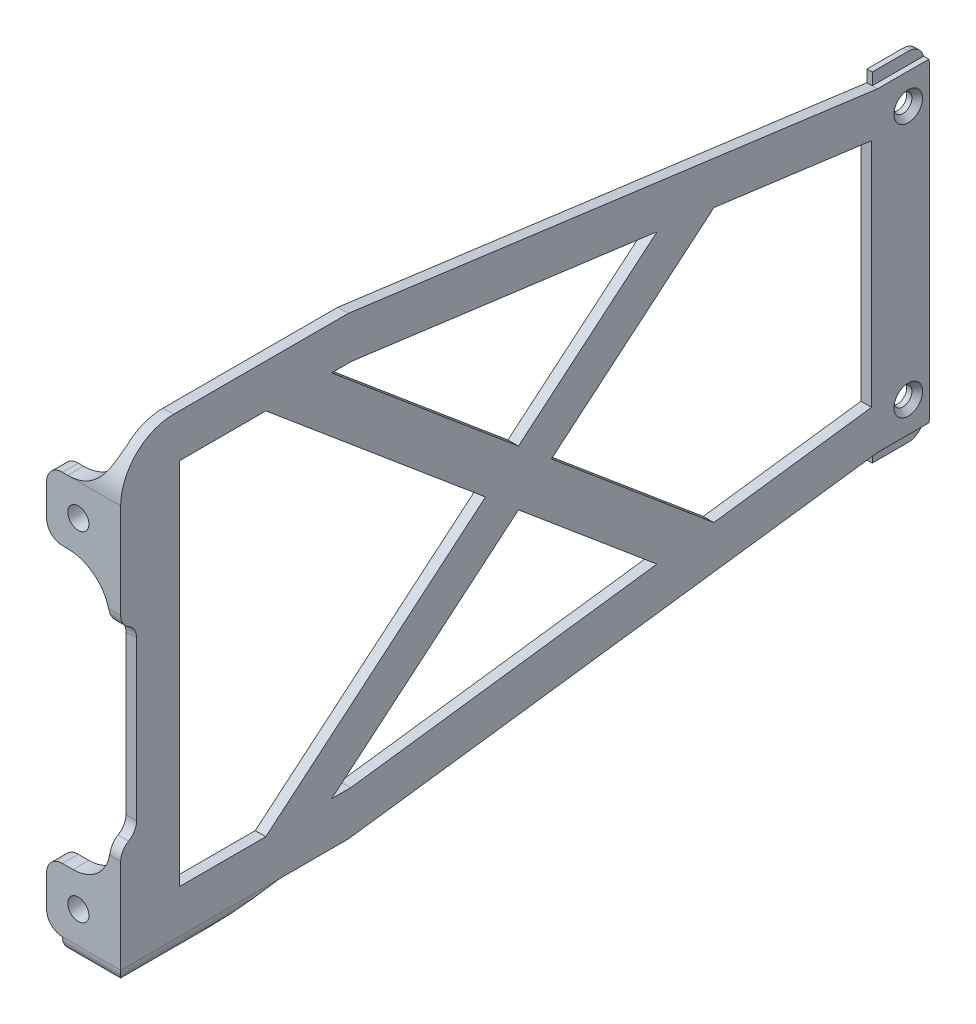
from build123d import *

# Parameters (mm, degrees)
SKETCH1_W           = 9.8
SKETCH1_H           = 59.5
BOSS_EXTRUDE1_DEPTH = 2
SKETCH2_W           = 9.8
SKETCH2_H           = 64
BOSS_EXTRUDE2_DEPTH = 1
FILLET1_R           = 3
BOSS_EXTRUDE3_DEPTH = 2
SKETCH4_R           = 2
BOSS_EXTRUDE4_DEPTH = 3
FILLET2_R           = 3
FILLET3_R           = 3
SKETCH5_R           = 2
BOSS_EXTRUDE5_DEPTH = 3
FILLET4_R           = 10
FILLET6_R           = 3
FILLET7_R           = 3
BOSS_EXTRUDE6_DEPTH = 3
CHAMFER1_SIZE2      = 3
CHAMFER1_SIZE       = 17.013845459
FILLET10_R          = 3
CUT_EXTRUDE1_DEPTH  = 117.582838676
BOSS_EXTRUDE7_DEPTH = 2
SKETCH9_R           = 1.7
CUT_EXTRUDE2_DEPTH  = 117.582838676
CHAMFER2_SIZE       = 1


# Some blends are built 0.0001 mm under size
with BuildPart() as part:
    # Sketch1 → Boss-Extrude1 (new body)
    with BuildSketch(Plane(origin=(0, 0, 0), x_dir=(0, 0, -1), z_dir=(1, 0, 0))):
        with Locations((41.694735288, 0)):
            Rectangle(SKETCH1_W, SKETCH1_H)
    extrude(amount=BOSS_EXTRUDE1_DEPTH)

    # Sketch2 → Boss-Extrude2 (add)
    with BuildSketch(Plane(origin=(0, 0, 0), x_dir=(0, 0, -1), z_dir=(1, 0, 0))):
        with Locations((41.694735288, 0)):
            Rectangle(SKETCH2_W, SKETCH2_H)
    extrude(amount=BOSS_EXTRUDE2_DEPTH)

    # Fillet1
    fillet1_edges = [part.edges().sort_by_distance(p)[0] for p in [
        (0.5, -32, -46.594735288),
        (0.5, 32, -46.594735288),
    ]]
    fillet(fillet1_edges, radius=FILLET1_R)

    # Sketch3 → Boss-Extrude3 (add)
    with BuildSketch(Plane(origin=(0, 0, 0), x_dir=(0, 0, -1), z_dir=(1, 0, 0))):
        Polygon((36.794735288, 29.75), (-63.205264712, 43), (-103.205264712, 43), (-103.205264712, -43), (-63.205264712, -43), (36.794735288, -29.75), align=None)
    extrude(amount=BOSS_EXTRUDE3_DEPTH)

    # Sketch4 → Boss-Extrude4 (add)
    with BuildSketch(Plane.XY.offset(103.205264712)):
        with BuildLine():
            Line((2, -43), (-9, -43))
            ThreePointArc((-9, -43), (-11.121320344, -42.121320344), (-12, -40))
            Line((-12, -40), (-12, -34))
            ThreePointArc((-12, -34), (-11.121320344, -31.878679656), (-9, -31))
            Line((-9, -31), (-7, -31))
            ThreePointArc((-7, -31), (-2.050252532, -28.949747468), (0, -24))
            Line((0, -24), (0, -23))
            Line((0, -23), (2, -23))
            Line((2, -23), (2, -31))
            Line((2, -31), (2, -43))
        make_face()
        with Locations((-6, -37)):
            Circle(SKETCH4_R, mode=Mode.SUBTRACT)
    extrude(amount=BOSS_EXTRUDE4_DEPTH)

    # Fillet2
    fillet2_edges = [part.edges().sort_by_distance(p)[0] for p in [
        (1, -23, 103.205264712),
    ]]
    fillet(fillet2_edges, radius=FILLET2_R - 0.0001)  # a hair under: the kernel refuses the full size

    # Fillet3
    # the kernel refuses this fillet: 3 mm, written as the material it takes off along each edge
    with BuildSketch(Plane(origin=(-5.490486718, -23, 106.205264712), x_dir=(0, 0.2587982993664488, -0.9659313848535175), z_dir=(1, 0, 0))) as fillet3_piece_1:
        with BuildLine():
            CenterArc((2.329422704, -2.897768274), FILLET3_R, 105.000679234, 60.000551337)
            Line((-0.56837145, -2.121373376), (-0.858150866, -2.043733886))
            Line((-0.858150866, -2.043733886), (-0.289779415, 0.07763949))
            Line((-0.289779415, 0.07763949), (0.07763949, 0.289779415))
            ThreePointArc((0.07763949, 0.289779415), (0.077736083, 0.289753536), (1.475282068, 0.289776827))
            Line((1.475282068, 0.289776827), (1.552931216, 0))
        make_face()
    extrude(amount=12.980973437, mode=Mode.SUBTRACT)

    # Sketch5 → Boss-Extrude5 (add)
    with BuildSketch(Plane.XY.offset(103.205264712)):
        with BuildLine():
            Line((-8, 33), (-9, 33))
            ThreePointArc((-9, 33), (-11.121320344, 32.121320344), (-12, 30))
            Line((-12, 30), (-12, 24))
            ThreePointArc((-12, 24), (-11.121320344, 21.878679656), (-9, 21))
            Line((-9, 21), (-8, 21))
            ThreePointArc((-8, 21), (-2.343145751, 18.656854249), (0, 13))
            Line((0, 13), (0, 12.9))
            Line((0, 12.9), (2, 12.9))
            Line((2, 12.9), (2, 21))
            Line((2, 21), (2, 33))
            Line((2, 33), (2, 43))
            Line((2, 43), (0, 43))
            Line((0, 43), (0, 41))
            ThreePointArc((0, 41), (-2.343145751, 35.343145751), (-8, 33))
        make_face()
        with Locations((-6, 27)):
            Circle(SKETCH5_R, mode=Mode.SUBTRACT)
    extrude(amount=BOSS_EXTRUDE5_DEPTH)

    # Fillet4
    # the kernel refuses this fillet: 10 mm, written as the material it takes off along each edge
    with BuildSketch(Plane(origin=(27, 43, 106.205264712), x_dir=(0, 0, -1), z_dir=(-1, 0, 0))) as fillet4_piece_1:
        with BuildLine():
            CenterArc((FILLET4_R, FILLET4_R), FILLET4_R, 180, 90)
            Line((0, FILLET4_R), (0, 0))
            Line((0, 0), (FILLET4_R, 0))
        make_face()
    extrude(amount=52, mode=Mode.SUBTRACT)

    # Fillet6
    fillet6_edges = [part.edges().sort_by_distance(p)[0] for p in [
        (1, 12.9, 103.205264712),
    ]]
    fillet(fillet6_edges, radius=FILLET6_R - 0.0001)  # a hair under: the kernel refuses the full size

    # Fillet7
    # the kernel refuses this fillet: 3 mm, written as the material it takes off along each edge
    with BuildSketch(Plane(origin=(-5.490486718, 12.9, 106.205264712), x_dir=(0, -0.2587982993664468, -0.9659313848535179), z_dir=(1, 0, 0))) as fillet7_piece_1:
        with BuildLine():
            CenterArc((2.329422704, 2.897768274), FILLET7_R, 194.99876943, 60.000551337)
            Line((-0.56837145, 2.121373376), (-0.858150866, 2.043733886))
            Line((-0.858150866, 2.043733886), (-0.289779415, -0.07763949))
            Line((-0.289779415, -0.07763949), (0.07763949, -0.289779415))
            ThreePointArc((0.07763949, -0.289779415), (0.077736083, -0.289753536), (1.475282068, -0.289776827))
            Line((1.475282068, -0.289776827), (1.552931216, 0))
        make_face()
    extrude(amount=12.980973437, mode=Mode.SUBTRACT)

    # Sketch6 → Boss-Extrude6 (add)
    with BuildSketch(Plane.XZ.offset(43)):
        Polygon((2, 106.205264712), (-9, 106.205264712), (-9, 103.205264712), (0, 76.205264712), (2, 76.205264712), align=None)
    extrude(amount=BOSS_EXTRUDE6_DEPTH)

    # Chamfer1
    chamfer1_edges = [part.edges().sort_by_distance(p)[0] for p in [
        (1, -46, 76.205264712),
    ]]
    chamfer1_side = [part.faces().sort_by_distance(p)[0] for p in [
        (1, -46, 76.265264712),
    ]]
    chamfer(chamfer1_edges, length=CHAMFER1_SIZE - 0.0001, length2=CHAMFER1_SIZE2 - 0.0001, reference=chamfer1_side[0])  # a hair under: the kernel refuses the full size

    # Fillet10
    fillet10_edges = [part.edges().sort_by_distance(p)[0] for p in [
        (2, -46, 99.712137442),
        (-3.5, -46, 106.205264712),
    ]]
    fillet(fillet10_edges, radius=FILLET10_R)

    # Sketch7 → Cut-Extrude1 (cut, through all)
    with BuildSketch(Plane(origin=(2, 0, 0), x_dir=(0, 0, -1), z_dir=(1, 0, 0))):
        Polygon((35.650666719, 21.831669631), (35.650666719, -21.798973174), (-62.72810878, -34.834160927), (-95.091144317, -34.834160927), (-95.091144317, 34.834160927), (-62.481343063, 34.834160927), align=None)
    extrude(amount=-CUT_EXTRUDE1_DEPTH, mode=Mode.SUBTRACT)

    # Sketch8 → Boss-Extrude7 (add)
    with BuildSketch(Plane(origin=(2, 0, 0), x_dir=(0, 0, -1), z_dir=(1, 0, 0))):
        Polygon((-78.78624369, 34.834160927), (-37.27250726, 0), (-78.78624369, -34.834160927), (-66.340453075, -34.834160927), (-31.049611953, -5.221629157), (-4.891583353, -27.170821308), (-1.562241162, -29.964471113), (8.678277132, -28.114027922), (5.856936901, -25.746642374), (-24.826716646, 0), (5.856936901, 25.746642374), (7.77511163, 27.665346604), (-2.902361224, 28.796551739), (-4.891583353, 27.170821308), (-31.049611953, 5.221629157), (-66.340453075, 34.834160927), align=None)
    extrude(amount=-BOSS_EXTRUDE7_DEPTH)

    # Sketch9 → Cut-Extrude2 (cut, through all)
    with BuildSketch(Plane(origin=(2, 0, 0), x_dir=(0, 0, -1), z_dir=(1, 0, 0))):
        with Locations((42.594735288, 24)):
            Circle(SKETCH9_R)
        with Locations((42.594735288, -24)):
            Circle(SKETCH9_R)
    extrude(amount=-CUT_EXTRUDE2_DEPTH, mode=Mode.SUBTRACT)

    # Chamfer2
    chamfer2_edges = [part.edges().sort_by_distance(p)[0] for p in [
        (2, 24, -40.894735288),
        (2, -24, -40.894735288),
    ]]
    chamfer(chamfer2_edges, length=CHAMFER2_SIZE)


solid = part.part
